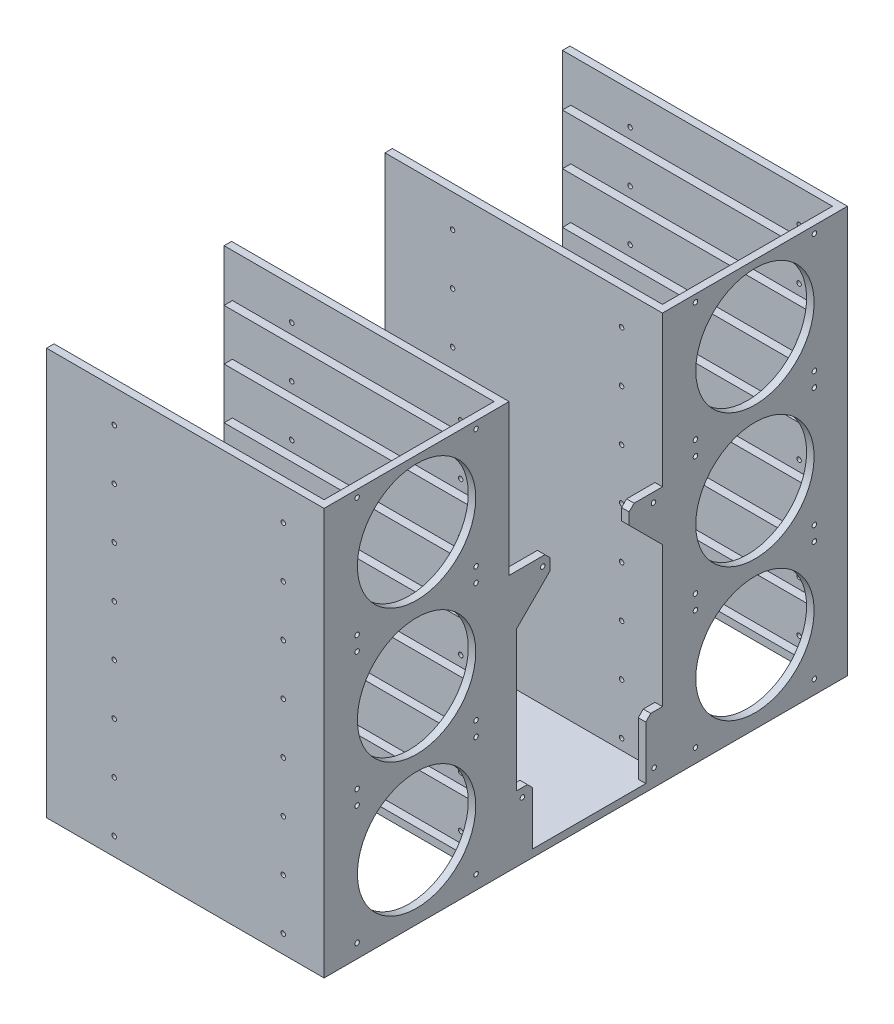
from build123d import *

# Parameters (mm, degrees)
SKETCH1_W                     = 166.5
SKETCH1_H                     = 111
BOSS_EXTRUDE1_DEPTH           = 30.5
SHELL1_T                      = -4.5
CUT_EXTRUDE1_REACH            = 105.377
SKETCH2_W                     = 157
SKETCH2_H                     = 92
TAP_DRILL_FOR_6_32_TAP1_D     = 2.7051
TAP_DRILL_FOR_6_32_TAP1_DEPTH = 4.5
LPATTERN1_COUNT               = 8
LPATTERN1_PITCH               = 30.5
SKETCH7_W                     = 102
SKETCH7_H                     = 4.5
CUT_EXTRUDE2_DEPTH            = 5
SKETCH8_W                     = 102
SKETCH8_H                     = 157
CUT_EXTRUDE3_DEPTH            = 5
CUT_EXTRUDE4_REACH            = 302.564
SKETCH9_R                     = 35.5
TAP_DRILL_FOR_6_32_TAP2_D     = 2.7051
SKETCH13_W                    = 166.5
SKETCH13_H                    = 92
BOSS_EXTRUDE2_DEPTH           = 4.5
SKETCH14_W                    = 4.5
SKETCH14_H                    = 149.2
BOSS_EXTRUDE3_DEPTH           = 4.5
LPATTERN2_COUNT               = 3
LPATTERN2_PITCH               = 81
CUT_EXTRUDE5_REACH            = 332.173
SKETCH15_W                    = 4.5
SKETCH15_H                    = 55.829149896
SKETCH15_H_2                  = 48.370850104
SKETCH16_W                    = 4.5
SKETCH16_H                    = 149.2
CUT_EXTRUDE6_DEPTH            = 166.5
CUT_EXTRUDE7_DEPTH            = 157
MIRROR6_COPY_1_DEPTH          = 157
BOSS_EXTRUDE4_DEPTH           = 4.5
BOSS_EXTRUDE5_DEPTH           = 4.5
DRIVE_NUB_DEPTH               = 4
LPATTERN3_COUNT               = 8
LPATTERN3_PITCH               = 30
MIRROR7_COPY_1_DEPTH          = 4
MIRROR7_COPY_2_DEPTH          = 4
MIRROR7_COPY_3_DEPTH          = 4
MIRROR7_COPY_4_DEPTH          = 4
MIRROR7_COPY_5_DEPTH          = 4
MIRROR7_COPY_6_DEPTH          = 4
MIRROR7_COPY_7_DEPTH          = 4
MIRROR8_COPY_1_DEPTH          = 4
MIRROR8_COPY_2_DEPTH          = 4
MIRROR8_COPY_3_DEPTH          = 4
MIRROR8_COPY_4_DEPTH          = 4
MIRROR8_COPY_5_DEPTH          = 4
MIRROR8_COPY_6_DEPTH          = 4
MIRROR8_COPY_7_DEPTH          = 4
MIRROR8_COPY_8_DEPTH          = 4
MIRROR8_COPY_9_DEPTH          = 4
MIRROR8_COPY_10_DEPTH         = 4
MIRROR8_COPY_11_DEPTH         = 4
MIRROR8_COPY_12_DEPTH         = 4
MIRROR8_COPY_13_DEPTH         = 4
MIRROR8_COPY_14_DEPTH         = 4
MIRROR8_COPY_15_DEPTH         = 4
SKETCH20_W                    = 14
SKETCH20_H                    = 35
BOSS_EXTRUDE7_DEPTH           = 4.5
SKETCH24_W                    = 10
SKETCH24_H                    = 35
BOSS_EXTRUDE8_DEPTH           = 4.5
CUT_EXTRUDE8_REACH            = 394.531
SKETCH25_R                    = 1.355
CHAMFER1_SIZE                 = 3
SKETCH26_W                    = 20
SKETCH26_H                    = 20
BOSS_EXTRUDE9_DEPTH           = 4.5
CUT_EXTRUDE9_REACH            = 394.531
SKETCH27_R                    = 1.355
BOSS_EXTRUDE10_DEPTH          = 4.5
CUT_EXTRUDE10_REACH           = 394.531
CHAMFER2_SIZE                 = 3


with BuildPart() as part:
    # Sketch1 → Boss-Extrude1 (new body)
    with BuildSketch(Plane(origin=(0, 0, 0), x_dir=(1, 0, 0), z_dir=(0, 1, 0))):
        Rectangle(SKETCH1_W, SKETCH1_H)
    extrude(amount=BOSS_EXTRUDE1_DEPTH)

    # Shell1
    shell1_openings = [part.faces().sort_by_distance(p)[0] for p in [
        (0, 30.5, 0),
        (-83.25, 15.25, 0),
    ]]
    offset(amount=SHELL1_T, openings=shell1_openings, kind=Kind.INTERSECTION)

    # Sketch2 → Cut-Extrude1 (cut, up to next)
    with BuildSketch(Plane(origin=(0, 4.5, 0), x_dir=(1, 0, 0), z_dir=(0, 1, 0)), mode=Mode.PRIVATE) as cut_extrude1_sk1:
        with Locations((0.25, 0)):
            Rectangle(SKETCH2_W, SKETCH2_H)
    cut_extrude1_tool1 = extrude(cut_extrude1_sk1.sketch, amount=-CUT_EXTRUDE1_REACH, mode=Mode.PRIVATE) & part.part
    add(cut_extrude1_tool1.solids().sort_by_distance((0.25, 4.5, 0))[0], mode=Mode.SUBTRACT)

    # Tap Drill for #6-32 Tap1
    with Locations(Plane(origin=(0, 0, -55.5), x_dir=(-1, 0, 0), z_dir=(0, 0, -1))):
        with Locations((42.66, 10.84), (-58.75, 10.84)):
            tap_drill_for_6_32_tap1 = Hole(TAP_DRILL_FOR_6_32_TAP1_D / 2, depth=TAP_DRILL_FOR_6_32_TAP1_DEPTH)

    # Mirror1: Tap Drill for #6-32 Tap1 across plane
    add(tap_drill_for_6_32_tap1.mirror(Plane.XY), mode=Mode.SUBTRACT)


with BuildPart() as lpattern1_1:
    # LPattern1: pattern copy
    add(part.part.moved(Location(Vector(0, 1, 0) * (1 * LPATTERN1_PITCH))))


with BuildPart() as lpattern1_2:
    # LPattern1: pattern copy
    add(part.part.moved(Location(Vector(0, 1, 0) * (2 * LPATTERN1_PITCH))))


with BuildPart() as lpattern1_3:
    # LPattern1: pattern copy
    add(part.part.moved(Location(Vector(0, 1, 0) * (3 * LPATTERN1_PITCH))))


with BuildPart() as lpattern1_4:
    # LPattern1: pattern copy
    add(part.part.moved(Location(Vector(0, 1, 0) * (4 * LPATTERN1_PITCH))))


with BuildPart() as lpattern1_5:
    # LPattern1: pattern copy
    add(part.part.moved(Location(Vector(0, 1, 0) * (5 * LPATTERN1_PITCH))))


with BuildPart() as lpattern1_6:
    # LPattern1: pattern copy
    add(part.part.moved(Location(Vector(0, 1, 0) * (6 * LPATTERN1_PITCH))))


with BuildPart() as lpattern1_7:
    # LPattern1: pattern copy
    add(part.part.moved(Location(Vector(0, 1, 0) * (7 * LPATTERN1_PITCH))))


with BuildPart() as part_1:
    add(part.part)

    # Combine1: union LPattern1_1
    add(lpattern1_1.part)

    # Sketch7 → Cut-Extrude2 (cut)
    with BuildSketch(Plane.ZY.offset(83.25)):
        with Locations((0, 32.75)):
            Rectangle(SKETCH7_W, SKETCH7_H)
    extrude(amount=-CUT_EXTRUDE2_DEPTH, mode=Mode.SUBTRACT)


with BuildPart() as lpattern1_2_1:
    add(lpattern1_2.part)

    # Combine2: union LPattern1_3, LPattern1_5, LPattern1_4, LPattern1_7, part, LPattern1_6
    add(lpattern1_3.part)
    add(lpattern1_5.part)
    add(lpattern1_4.part)
    add(lpattern1_7.part)
    add(part_1.part)
    add(lpattern1_6.part)

    # Sketch8 → Cut-Extrude3 (cut)
    with BuildSketch(Plane.ZY.offset(83.25)):
        with Locations((0, 139.5)):
            Rectangle(SKETCH8_W, SKETCH8_H)
    extrude(amount=-CUT_EXTRUDE3_DEPTH, mode=Mode.SUBTRACT)

    # Sketch9 → Cut-Extrude4 (cut, up to next)
    with BuildSketch(Plane(origin=(83.25, 0, 0), x_dir=(0, 0, -1), z_dir=(1, 0, 0)), mode=Mode.PRIVATE) as cut_extrude4_sk1:
        with Locations((0, 204)):
            Circle(SKETCH9_R)
    cut_extrude4_tool1 = extrude(cut_extrude4_sk1.sketch, amount=-CUT_EXTRUDE4_REACH, mode=Mode.PRIVATE) & lpattern1_2_1.part
    # Sketch9 → Cut-Extrude4 (cut, up to next)
    with BuildSketch(Plane(origin=(83.25, 0, 0), x_dir=(0, 0, -1), z_dir=(1, 0, 0)), mode=Mode.PRIVATE) as cut_extrude4_sk2:
        with Locations((0, 124)):
            Circle(SKETCH9_R)
    cut_extrude4_tool2 = extrude(cut_extrude4_sk2.sketch, amount=-CUT_EXTRUDE4_REACH, mode=Mode.PRIVATE) & lpattern1_2_1.part
    # Sketch9 → Cut-Extrude4 (cut, up to next)
    with BuildSketch(Plane(origin=(83.25, 0, 0), x_dir=(0, 0, -1), z_dir=(1, 0, 0)), mode=Mode.PRIVATE) as cut_extrude4_sk3:
        with Locations((0, 44)):
            Circle(SKETCH9_R)
    cut_extrude4_tool3 = extrude(cut_extrude4_sk3.sketch, amount=-CUT_EXTRUDE4_REACH, mode=Mode.PRIVATE) & lpattern1_2_1.part
    add(cut_extrude4_tool1.solids().sort_by_distance((83.25, 204, 0))[0], mode=Mode.SUBTRACT)
    add(cut_extrude4_tool2.solids().sort_by_distance((83.25, 124, 0))[0], mode=Mode.SUBTRACT)
    add(cut_extrude4_tool3.solids().sort_by_distance((83.25, 44, 0))[0], mode=Mode.SUBTRACT)

    # Tap Drill for #6-32 Tap2 (through all)
    with Locations(Plane(origin=(83.25, 0, 0), x_dir=(0, 0, -1), z_dir=(1, 0, 0))):
        with Locations((-35.675, 239.675), (35.675, 239.675), (35.675, 168.325), (-35.675, 168.325)):
            tap_drill_for_6_32_tap2 = Hole(TAP_DRILL_FOR_6_32_TAP2_D / 2)

    # Mirror2: Tap Drill for #6-32 Tap2 across plane
    add(tap_drill_for_6_32_tap2.mirror(Plane.ZX.offset(164)), mode=Mode.SUBTRACT)

    # Mirror3: Tap Drill for #6-32 Tap2 across plane
    add(tap_drill_for_6_32_tap2.mirror(Plane.ZX.offset(124)), mode=Mode.SUBTRACT)

    # Sketch13 → Boss-Extrude2 (add)
    with BuildSketch(Plane.XZ):
        with Locations((0, -101.5)):
            Rectangle(SKETCH13_W, SKETCH13_H)
    extrude(amount=-BOSS_EXTRUDE2_DEPTH)

    # Sketch14 → Boss-Extrude3 (add)
    with BuildSketch(Plane(origin=(0, 0, -55.5), x_dir=(-1, 0, 0), z_dir=(0, 0, -1))):
        with Locations((-81, 79.1)):
            Rectangle(SKETCH14_W, SKETCH14_H)
    boss_extrude3 = extrude(amount=BOSS_EXTRUDE3_DEPTH)

    # LPattern2: Boss-Extrude3 ×3
    with Locations(*[(-i * LPATTERN2_PITCH, 0, 0) for i in range(1, LPATTERN2_COUNT)]):
        add(boss_extrude3)

    # Cut-Extrude5: up to this face of the body (flat: up to its plane)
    cut_extrude5_end = Plane(lpattern1_2_1.part.faces().sort_by_distance((2.25, 79.1, -57.75))[0])
    # Sketch15 → Cut-Extrude5 (cut, up to the picked face)
    with BuildSketch(Plane.ZY.offset(83.25), mode=Mode.PRIVATE) as cut_extrude5_sk1:
        with Locations((-57.75, 110.785425052)):
            Rectangle(SKETCH15_W, SKETCH15_H)
    cut_extrude5_tool1 = split(extrude(cut_extrude5_sk1.sketch, amount=-CUT_EXTRUDE5_REACH, mode=Mode.PRIVATE), bisect_by=cut_extrude5_end, keep=Keep.BOTH, mode=Mode.PRIVATE)
    # Sketch15 → Cut-Extrude5 (cut, up to the picked face)
    with BuildSketch(Plane.ZY.offset(83.25), mode=Mode.PRIVATE) as cut_extrude5_sk2:
        with Locations((-57.75, 43.685425052)):
            Rectangle(SKETCH15_W, SKETCH15_H_2)
    cut_extrude5_tool2 = split(extrude(cut_extrude5_sk2.sketch, amount=-CUT_EXTRUDE5_REACH, mode=Mode.PRIVATE), bisect_by=cut_extrude5_end, keep=Keep.BOTH, mode=Mode.PRIVATE)
    add(cut_extrude5_tool1.solids().sort_by(Axis((-83.25, 110.785425, -57.75), (1, 0, 0)))[0], mode=Mode.SUBTRACT)
    add(cut_extrude5_tool2.solids().sort_by(Axis((-83.25, 43.685425, -57.75), (1, 0, 0)))[0], mode=Mode.SUBTRACT)

    # Mirror4: LPattern1_2 across plane


with BuildPart() as lpattern1_2_2:
    add(lpattern1_2_1.part)
    add(lpattern1_2_1.part.mirror(Plane(origin=(0, 0, -101.5), x_dir=(1, 0, 0), z_dir=(0, 0, -1))))

    # Sketch16 → Cut-Extrude6 (cut)
    with BuildSketch(Plane.ZY.offset(83.25)):
        with Locations((-145.25, 79.1)):
            Rectangle(SKETCH16_W, SKETCH16_H)
    extrude(amount=-CUT_EXTRUDE6_DEPTH, mode=Mode.SUBTRACT)

    # Sketch17 → Cut-Extrude7 (cut)
    with BuildSketch(Plane.ZY.offset(78.25)):
        Polygon((-46, 35), (-51, 30.5), (-46, 30.5), align=None)
        Polygon((-51, 61), (-46, 65.5), (-46, 61), align=None)
        Polygon((-51, 91.5), (-46, 96), (-46, 91.5), align=None)
        Polygon((-51, 122), (-46, 126.5), (-46, 122), align=None)
        Polygon((-51, 152.5), (-46, 157), (-46, 152.5), align=None)
        Polygon((-51, 183), (-46, 187.5), (-46, 183), align=None)
        Polygon((-51, 213.5), (-46, 218), (-46, 213.5), align=None)
    cut_extrude7 = extrude(amount=-CUT_EXTRUDE7_DEPTH, mode=Mode.SUBTRACT)

    # Mirror5: Cut-Extrude7 across plane
    add(cut_extrude7.mirror(Plane.XY), mode=Mode.SUBTRACT)

    # Mirror6: Cut-Extrude7 across plane
    add(cut_extrude7.mirror(Plane(origin=(0, 0, -101.5), x_dir=(1, 0, 0), z_dir=(0, 0, -1))), mode=Mode.SUBTRACT)

    # Mirror6 copy 1 sketch → Mirror6 copy 1 (cut)
    with BuildSketch(Plane(origin=(-78.25, 0, -203), x_dir=(0, 0, 1), z_dir=(-1, 0, 0))):
        Polygon((-46, 35), (-51, 30.5), (-46, 30.5), align=None)
        Polygon((-51, 61), (-46, 65.5), (-46, 61), align=None)
        Polygon((-51, 91.5), (-46, 96), (-46, 91.5), align=None)
        Polygon((-51, 122), (-46, 126.5), (-46, 122), align=None)
        Polygon((-51, 152.5), (-46, 157), (-46, 152.5), align=None)
        Polygon((-51, 183), (-46, 187.5), (-46, 183), align=None)
        Polygon((-51, 213.5), (-46, 218), (-46, 213.5), align=None)
    extrude(amount=-MIRROR6_COPY_1_DEPTH, mode=Mode.SUBTRACT)

    # Sketch18 → Boss-Extrude4 (add)
    with BuildSketch(Plane.ZY.offset(83.25)):
        Polygon((-60, 138.7), (-55.5, 130.905771366), (-55.5, 138.7), align=None)
        Polygon((-60, 67.870850104), (-55.5, 67.870850104), (-55.5, 60.07662147), align=None)
    extrude(amount=-BOSS_EXTRUDE4_DEPTH)

    # Sketch19 → Boss-Extrude5 (add)
    with BuildSketch(Plane.ZY.offset(2.25)):
        Polygon((-60, 67.870850104), (-55.5, 60.07662147), (-55.5, 67.870850104), align=None)
        Polygon((-60, 138.7), (-55.5, 130.905771366), (-55.5, 138.7), align=None)
    extrude(amount=-BOSS_EXTRUDE5_DEPTH)

    # Sketch22 → Drive Nub (add)
    with BuildSketch(Plane.XY.offset(-51)):
        Polygon((78.75, 13.5), (74.75, 17.5), (74.75, 21.5), (78.75, 21.5), align=None)
    drive_nub = extrude(amount=DRIVE_NUB_DEPTH)

    # LPattern3: Drive Nub ×8
    with Locations(*[(0, i * LPATTERN3_PITCH, 0) for i in range(1, LPATTERN3_COUNT)]):
        add(drive_nub)

    # Mirror7: Drive Nub across plane
    add(drive_nub.mirror(Plane.XY))

    # Mirror7 copy 1 sketch → Mirror7 copy 1 (add)
    with BuildSketch(Plane(origin=(0, 30, 51), x_dir=(1, 0, 0), z_dir=(0, 0, -1))):
        Polygon((78.75, -13.5), (74.75, -17.5), (74.75, -21.5), (78.75, -21.5), align=None)
    extrude(amount=MIRROR7_COPY_1_DEPTH)

    # Mirror7 copy 2 sketch → Mirror7 copy 2 (add)
    with BuildSketch(Plane(origin=(0, 60, 51), x_dir=(1, 0, 0), z_dir=(0, 0, -1))):
        Polygon((78.75, -13.5), (74.75, -17.5), (74.75, -21.5), (78.75, -21.5), align=None)
    extrude(amount=MIRROR7_COPY_2_DEPTH)

    # Mirror7 copy 3 sketch → Mirror7 copy 3 (add)
    with BuildSketch(Plane(origin=(0, 90, 51), x_dir=(1, 0, 0), z_dir=(0, 0, -1))):
        Polygon((78.75, -13.5), (74.75, -17.5), (74.75, -21.5), (78.75, -21.5), align=None)
    extrude(amount=MIRROR7_COPY_3_DEPTH)

    # Mirror7 copy 4 sketch → Mirror7 copy 4 (add)
    with BuildSketch(Plane(origin=(0, 120, 51), x_dir=(1, 0, 0), z_dir=(0, 0, -1))):
        Polygon((78.75, -13.5), (74.75, -17.5), (74.75, -21.5), (78.75, -21.5), align=None)
    extrude(amount=MIRROR7_COPY_4_DEPTH)

    # Mirror7 copy 5 sketch → Mirror7 copy 5 (add)
    with BuildSketch(Plane(origin=(0, 150, 51), x_dir=(1, 0, 0), z_dir=(0, 0, -1))):
        Polygon((78.75, -13.5), (74.75, -17.5), (74.75, -21.5), (78.75, -21.5), align=None)
    extrude(amount=MIRROR7_COPY_5_DEPTH)

    # Mirror7 copy 6 sketch → Mirror7 copy 6 (add)
    with BuildSketch(Plane(origin=(0, 180, 51), x_dir=(1, 0, 0), z_dir=(0, 0, -1))):
        Polygon((78.75, -13.5), (74.75, -17.5), (74.75, -21.5), (78.75, -21.5), align=None)
    extrude(amount=MIRROR7_COPY_6_DEPTH)

    # Mirror7 copy 7 sketch → Mirror7 copy 7 (add)
    with BuildSketch(Plane(origin=(0, 210, 51), x_dir=(1, 0, 0), z_dir=(0, 0, -1))):
        Polygon((78.75, -13.5), (74.75, -17.5), (74.75, -21.5), (78.75, -21.5), align=None)
    extrude(amount=MIRROR7_COPY_7_DEPTH)

    # Mirror8: Drive Nub across plane
    add(drive_nub.mirror(Plane(origin=(0, 0, -101.5), x_dir=(1, 0, 0), z_dir=(0, 0, -1))))

    # Mirror8 copy 1 sketch → Mirror8 copy 1 (add)
    with BuildSketch(Plane(origin=(0, 30, -152), x_dir=(1, 0, 0), z_dir=(0, 0, -1))):
        Polygon((78.75, -13.5), (74.75, -17.5), (74.75, -21.5), (78.75, -21.5), align=None)
    extrude(amount=MIRROR8_COPY_1_DEPTH)

    # Mirror8 copy 2 sketch → Mirror8 copy 2 (add)
    with BuildSketch(Plane(origin=(0, 60, -152), x_dir=(1, 0, 0), z_dir=(0, 0, -1))):
        Polygon((78.75, -13.5), (74.75, -17.5), (74.75, -21.5), (78.75, -21.5), align=None)
    extrude(amount=MIRROR8_COPY_2_DEPTH)

    # Mirror8 copy 3 sketch → Mirror8 copy 3 (add)
    with BuildSketch(Plane(origin=(0, 90, -152), x_dir=(1, 0, 0), z_dir=(0, 0, -1))):
        Polygon((78.75, -13.5), (74.75, -17.5), (74.75, -21.5), (78.75, -21.5), align=None)
    extrude(amount=MIRROR8_COPY_3_DEPTH)

    # Mirror8 copy 4 sketch → Mirror8 copy 4 (add)
    with BuildSketch(Plane(origin=(0, 120, -152), x_dir=(1, 0, 0), z_dir=(0, 0, -1))):
        Polygon((78.75, -13.5), (74.75, -17.5), (74.75, -21.5), (78.75, -21.5), align=None)
    extrude(amount=MIRROR8_COPY_4_DEPTH)

    # Mirror8 copy 5 sketch → Mirror8 copy 5 (add)
    with BuildSketch(Plane(origin=(0, 150, -152), x_dir=(1, 0, 0), z_dir=(0, 0, -1))):
        Polygon((78.75, -13.5), (74.75, -17.5), (74.75, -21.5), (78.75, -21.5), align=None)
    extrude(amount=MIRROR8_COPY_5_DEPTH)

    # Mirror8 copy 6 sketch → Mirror8 copy 6 (add)
    with BuildSketch(Plane(origin=(0, 180, -152), x_dir=(1, 0, 0), z_dir=(0, 0, -1))):
        Polygon((78.75, -13.5), (74.75, -17.5), (74.75, -21.5), (78.75, -21.5), align=None)
    extrude(amount=MIRROR8_COPY_6_DEPTH)

    # Mirror8 copy 7 sketch → Mirror8 copy 7 (add)
    with BuildSketch(Plane(origin=(0, 210, -152), x_dir=(1, 0, 0), z_dir=(0, 0, -1))):
        Polygon((78.75, -13.5), (74.75, -17.5), (74.75, -21.5), (78.75, -21.5), align=None)
    extrude(amount=MIRROR8_COPY_7_DEPTH)

    # Mirror8 copy 8 sketch → Mirror8 copy 8 (add)
    with BuildSketch(Plane.XY.offset(-254)):
        Polygon((78.75, 13.5), (74.75, 17.5), (74.75, 21.5), (78.75, 21.5), align=None)
    extrude(amount=MIRROR8_COPY_8_DEPTH)

    # Mirror8 copy 9 sketch → Mirror8 copy 9 (add)
    with BuildSketch(Plane(origin=(0, 30, -254), x_dir=(1, 0, 0), z_dir=(0, 0, 1))):
        Polygon((78.75, 13.5), (74.75, 17.5), (74.75, 21.5), (78.75, 21.5), align=None)
    extrude(amount=MIRROR8_COPY_9_DEPTH)

    # Mirror8 copy 10 sketch → Mirror8 copy 10 (add)
    with BuildSketch(Plane(origin=(0, 60, -254), x_dir=(1, 0, 0), z_dir=(0, 0, 1))):
        Polygon((78.75, 13.5), (74.75, 17.5), (74.75, 21.5), (78.75, 21.5), align=None)
    extrude(amount=MIRROR8_COPY_10_DEPTH)

    # Mirror8 copy 11 sketch → Mirror8 copy 11 (add)
    with BuildSketch(Plane(origin=(0, 90, -254), x_dir=(1, 0, 0), z_dir=(0, 0, 1))):
        Polygon((78.75, 13.5), (74.75, 17.5), (74.75, 21.5), (78.75, 21.5), align=None)
    extrude(amount=MIRROR8_COPY_11_DEPTH)

    # Mirror8 copy 12 sketch → Mirror8 copy 12 (add)
    with BuildSketch(Plane(origin=(0, 120, -254), x_dir=(1, 0, 0), z_dir=(0, 0, 1))):
        Polygon((78.75, 13.5), (74.75, 17.5), (74.75, 21.5), (78.75, 21.5), align=None)
    extrude(amount=MIRROR8_COPY_12_DEPTH)

    # Mirror8 copy 13 sketch → Mirror8 copy 13 (add)
    with BuildSketch(Plane(origin=(0, 150, -254), x_dir=(1, 0, 0), z_dir=(0, 0, 1))):
        Polygon((78.75, 13.5), (74.75, 17.5), (74.75, 21.5), (78.75, 21.5), align=None)
    extrude(amount=MIRROR8_COPY_13_DEPTH)

    # Mirror8 copy 14 sketch → Mirror8 copy 14 (add)
    with BuildSketch(Plane(origin=(0, 180, -254), x_dir=(1, 0, 0), z_dir=(0, 0, 1))):
        Polygon((78.75, 13.5), (74.75, 17.5), (74.75, 21.5), (78.75, 21.5), align=None)
    extrude(amount=MIRROR8_COPY_14_DEPTH)

    # Mirror8 copy 15 sketch → Mirror8 copy 15 (add)
    with BuildSketch(Plane(origin=(0, 210, -254), x_dir=(1, 0, 0), z_dir=(0, 0, 1))):
        Polygon((78.75, 13.5), (74.75, 17.5), (74.75, 21.5), (78.75, 21.5), align=None)
    extrude(amount=MIRROR8_COPY_15_DEPTH)

    # Sketch20 → Boss-Extrude7 (add)
    with BuildSketch(Plane(origin=(83.25, 0, 0), x_dir=(0, 0, -1), z_dir=(1, 0, 0))):
        with Locations((62.5, 22)):
            Rectangle(SKETCH20_W, SKETCH20_H)
    extrude(amount=-BOSS_EXTRUDE7_DEPTH)

    # Sketch24 → Boss-Extrude8 (add)
    with BuildSketch(Plane(origin=(83.25, 0, 0), x_dir=(0, 0, -1), z_dir=(1, 0, 0))):
        with Locations((142.5, 22)):
            Rectangle(SKETCH24_W, SKETCH24_H)
    extrude(amount=-BOSS_EXTRUDE8_DEPTH)

    # Sketch25 → Cut-Extrude8 (cut, up to next)
    with BuildSketch(Plane(origin=(83.25, 0, 0), x_dir=(0, 0, -1), z_dir=(1, 0, 0)), mode=Mode.PRIVATE) as cut_extrude8_sk1:
        with Locations((63.485, 34.355)):
            Circle(SKETCH25_R)
    cut_extrude8_tool1 = extrude(cut_extrude8_sk1.sketch, amount=-CUT_EXTRUDE8_REACH, mode=Mode.PRIVATE) & lpattern1_2_2.part
    # Sketch25 → Cut-Extrude8 (cut, up to next)
    with BuildSketch(Plane(origin=(83.25, 0, 0), x_dir=(0, 0, -1), z_dir=(1, 0, 0)), mode=Mode.PRIVATE) as cut_extrude8_sk2:
        with Locations((142.555, 10.255)):
            Circle(SKETCH25_R)
    cut_extrude8_tool2 = extrude(cut_extrude8_sk2.sketch, amount=-CUT_EXTRUDE8_REACH, mode=Mode.PRIVATE) & lpattern1_2_2.part
    add(cut_extrude8_tool1.solids().sort_by_distance((83.25, 34.355, -63.485))[0], mode=Mode.SUBTRACT)
    add(cut_extrude8_tool2.solids().sort_by_distance((83.25, 10.255, -142.555))[0], mode=Mode.SUBTRACT)

    # Chamfer1
    chamfer1_edges = [lpattern1_2_2.edges().sort_by_distance(p)[0] for p in [
        (81, 39.5, -69.5),
        (81, 39.5, -137.5),
    ]]
    chamfer(chamfer1_edges, length=CHAMFER1_SIZE)

    # Sketch26 → Boss-Extrude9 (add)
    with BuildSketch(Plane(origin=(83.25, 0, 0), x_dir=(0, 0, -1), z_dir=(1, 0, 0))):
        with Locations((70, 143.7)):
            Rectangle(SKETCH26_W, SKETCH26_H)
        with Locations((137.5, 143.7)):
            Rectangle(SKETCH26_W, SKETCH26_H)
    extrude(amount=-BOSS_EXTRUDE9_DEPTH)

    # Sketch27 → Cut-Extrude9 (cut, up to next)
    with BuildSketch(Plane(origin=(83.25, 0, 0), x_dir=(0, 0, -1), z_dir=(1, 0, 0)), mode=Mode.PRIVATE) as cut_extrude9_sk1:
        with Locations((75.705, 148.145)):
            Circle(SKETCH27_R)
    cut_extrude9_tool1 = extrude(cut_extrude9_sk1.sketch, amount=-CUT_EXTRUDE9_REACH, mode=Mode.PRIVATE) & lpattern1_2_2.part
    # Sketch27 → Cut-Extrude9 (cut, up to next)
    with BuildSketch(Plane(origin=(83.25, 0, 0), x_dir=(0, 0, -1), z_dir=(1, 0, 0)), mode=Mode.PRIVATE) as cut_extrude9_sk2:
        with Locations((142.145, 148.145)):
            Circle(SKETCH27_R)
    cut_extrude9_tool2 = extrude(cut_extrude9_sk2.sketch, amount=-CUT_EXTRUDE9_REACH, mode=Mode.PRIVATE) & lpattern1_2_2.part
    add(cut_extrude9_tool1.solids().sort_by_distance((83.25, 148.145, -75.705))[0], mode=Mode.SUBTRACT)
    add(cut_extrude9_tool2.solids().sort_by_distance((83.25, 148.145, -142.145))[0], mode=Mode.SUBTRACT)

    # Sketch28 → Boss-Extrude10 (add)
    with BuildSketch(Plane(origin=(83.25, 0, 0), x_dir=(0, 0, -1), z_dir=(1, 0, 0))):
        Polygon((80, 143.7), (60, 123.7), (60, 143.7), align=None)
        Polygon((127.5, 143.7), (147.5, 123.7), (147.5, 143.7), align=None)
    extrude(amount=-BOSS_EXTRUDE10_DEPTH)

    # Sketch29 → Cut-Extrude10 (cut, up to next)
    with BuildSketch(Plane(origin=(83.25, 0, 0), x_dir=(0, 0, -1), z_dir=(1, 0, 0)), mode=Mode.PRIVATE) as cut_extrude10_sk1:
        Polygon((70, 133.7), (80, 143.7), (80, 133.7), align=None)
    cut_extrude10_tool1 = extrude(cut_extrude10_sk1.sketch, amount=-CUT_EXTRUDE10_REACH, mode=Mode.PRIVATE) & lpattern1_2_2.part
    # Sketch29 → Cut-Extrude10 (cut, up to next)
    with BuildSketch(Plane(origin=(83.25, 0, 0), x_dir=(0, 0, -1), z_dir=(1, 0, 0)), mode=Mode.PRIVATE) as cut_extrude10_sk2:
        Polygon((127.5, 133.7), (137.5, 133.7), (127.5, 143.7), align=None)
    cut_extrude10_tool2 = extrude(cut_extrude10_sk2.sketch, amount=-CUT_EXTRUDE10_REACH, mode=Mode.PRIVATE) & lpattern1_2_2.part
    add(cut_extrude10_tool1.solids().sort_by_distance((83.25, 137.033333, -76.666667))[0], mode=Mode.SUBTRACT)
    add(cut_extrude10_tool2.solids().sort_by_distance((83.25, 137.033333, -130.833333))[0], mode=Mode.SUBTRACT)

    # Chamfer2
    chamfer2_edges = [lpattern1_2_2.edges().sort_by_distance(p)[0] for p in [
        (81, 153.7, -80),
        (81, 153.7, -127.5),
    ]]
    chamfer(chamfer2_edges, length=CHAMFER2_SIZE)


solid = lpattern1_2_2.part
